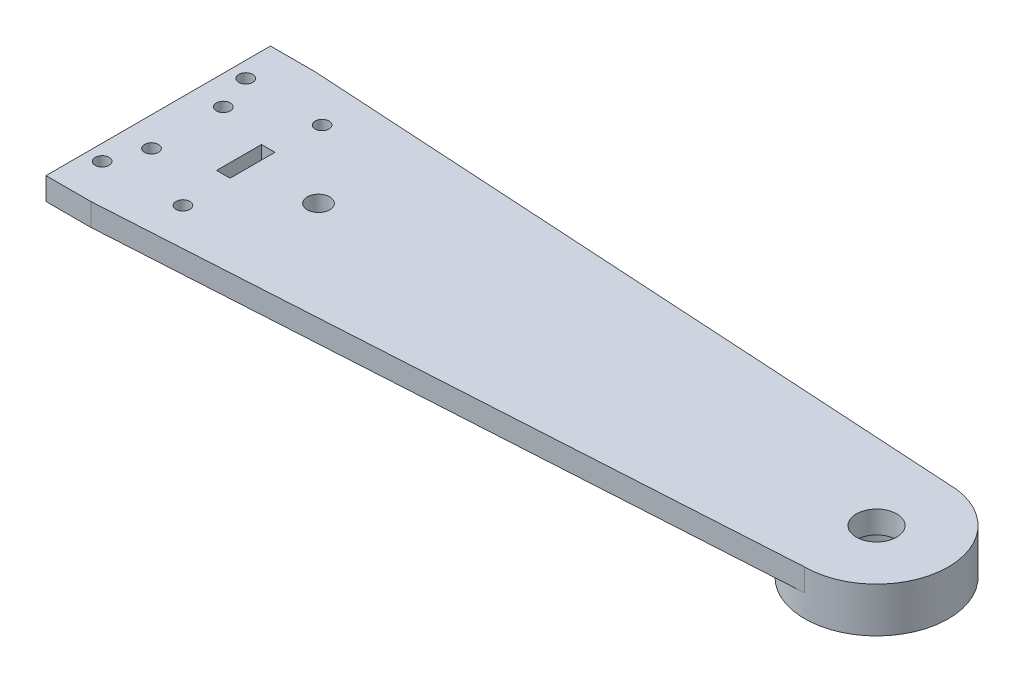
from build123d import *
from build123d.topology import SkipClean

# Parameters (mm, degrees)
SKETCH28_R           = 1.55
SKETCH28_R_2         = 2.5
SKETCH28_R_3         = 4.5
SKETCH28_W           = 10
SKETCH28_H           = 3
BOSS_EXTRUDE10_DEPTH = 5
SKETCH29_R           = 16
SKETCH29_R_2         = 8.2
SKETCH29_R_3         = 10
SKETCH29_R_4         = 6.7
BOSS_EXTRUDE11_DEPTH = 5


with BuildPart() as part:
    # Sketch28 → Boss-Extrude10 (new body)
    with BuildSketch(Plane(origin=(-32, 0, 0), x_dir=(0, 0, 1), z_dir=(0, -1, 0))):
        with BuildLine():
            Line((-25, 15), (25, 15))
            Line((25, 15), (25, 5))
            Line((25, 5), (16, -145))
            ThreePointArc((16, -145), (0, -161), (-16, -145))
            Line((-16, -145), (-25, 5))
            Line((-25, 5), (-25, 15))
        make_face()
        with Locations((8, 8.5)):
            Circle(SKETCH28_R, mode=Mode.SUBTRACT)
        with Locations((-8, 8.5)):
            Circle(SKETCH28_R, mode=Mode.SUBTRACT)
        with Locations((16, 11.5)):
            Circle(SKETCH28_R, mode=Mode.SUBTRACT)
        with Locations((-16, 11.5)):
            Circle(SKETCH28_R, mode=Mode.SUBTRACT)
        with Locations((-15.5, -6)):
            Circle(SKETCH28_R, mode=Mode.SUBTRACT)
        with Locations((15.5, -6)):
            Circle(SKETCH28_R, mode=Mode.SUBTRACT)
        with Locations((0, -20.7)):
            Circle(SKETCH28_R_2, mode=Mode.SUBTRACT)
        with Locations((0, -145)):
            Circle(SKETCH28_R_3, mode=Mode.SUBTRACT)
        with Locations((0, -4.5)):
            Rectangle(SKETCH28_W, SKETCH28_H, mode=Mode.SUBTRACT)
    extrude(amount=BOSS_EXTRUDE10_DEPTH)

    # Sketch29 → Boss-Extrude11 (add)
    # profile 1 of 2: a face of its own
    with SkipClean():  # the faces are left unmerged after this step: merging them gives an invalid solid
        with BuildSketch(Plane.XZ.offset(5)):
            with Locations((113, 0)):
                Circle(SKETCH29_R)
            with Locations((113, 0)):
                Circle(SKETCH29_R_2, mode=Mode.SUBTRACT)
        # profile 2 of 2: a face of its own
        with BuildSketch(Plane.XZ.offset(5)):
            with Locations((-11.3, 0)):
                Circle(SKETCH29_R_3)
            with Locations((-11.3, 0)):
                Circle(SKETCH29_R_4, mode=Mode.SUBTRACT)
        extrude(amount=BOSS_EXTRUDE11_DEPTH)
    add(part.part.scale(1), mode=Mode.REPLACE)  # the faces are merged on a copy


solid = part.part
